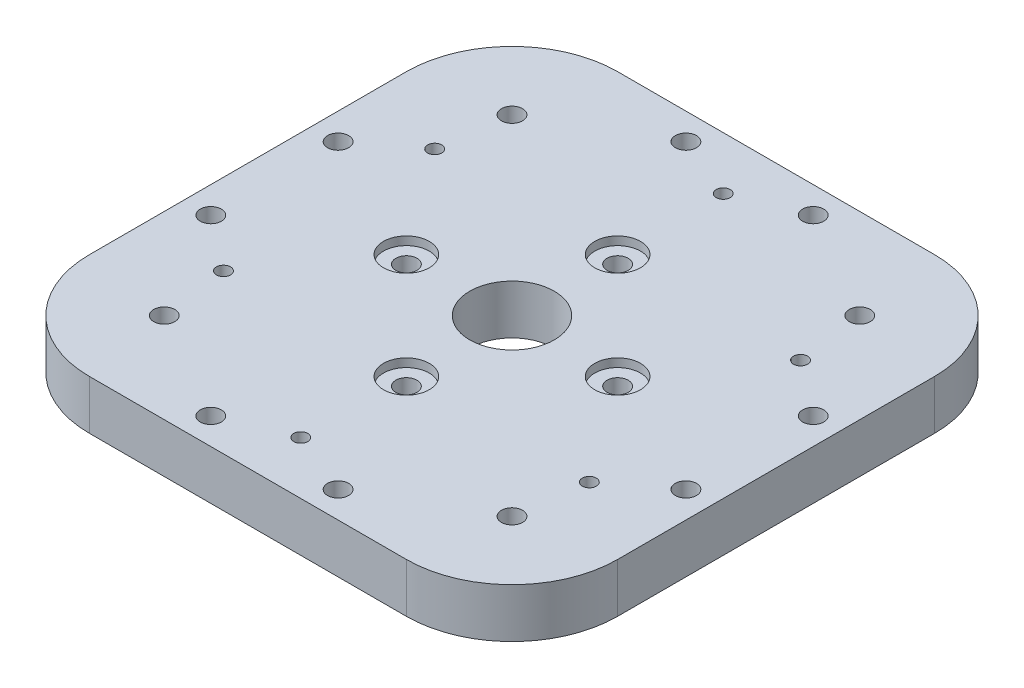
from build123d import *

# Parameters (mm, degrees)
SKETCH1_W           = 75
SKETCH1_H           = 75
SKETCH1_R           = 6
SKETCH1_R_2         = 1.5
SKETCH1_R_3         = 1
BOSS_EXTRUDE1_DEPTH = 7
SKETCH2_R           = 3.25
CUT_EXTRUDE1_DEPTH  = 1.2
FILLET1_R           = 15


with BuildPart() as part:
    # Sketch1 → Boss-Extrude1 (new body)
    with BuildSketch(Plane(origin=(0, 0, 0), x_dir=(1, 0, 0), z_dir=(0, 1, 0))):
        Rectangle(SKETCH1_W, SKETCH1_H)
        Circle(SKETCH1_R, mode=Mode.SUBTRACT)
        with Locations((0, 15)):
            Circle(SKETCH1_R_2, mode=Mode.SUBTRACT)
        with Locations((15, 0)):
            Circle(SKETCH1_R_2, mode=Mode.SUBTRACT)
        with Locations((0, -15)):
            Circle(SKETCH1_R_2, mode=Mode.SUBTRACT)
        with Locations((-15, 0)):
            Circle(SKETCH1_R_2, mode=Mode.SUBTRACT)
        with Locations((-33.737040436, -9.03981274)):
            Circle(SKETCH1_R_2, mode=Mode.SUBTRACT)
        with Locations((-33.737040436, 9.03981274)):
            Circle(SKETCH1_R_2, mode=Mode.SUBTRACT)
        with Locations((-24.697227696, 24.697227696)):
            Circle(SKETCH1_R_2, mode=Mode.SUBTRACT)
        with Locations((-9.03981274, 33.737040436)):
            Circle(SKETCH1_R_2, mode=Mode.SUBTRACT)
        with Locations((9.03981274, 33.737040436)):
            Circle(SKETCH1_R_2, mode=Mode.SUBTRACT)
        with Locations((24.697227696, 24.697227696)):
            Circle(SKETCH1_R_2, mode=Mode.SUBTRACT)
        with Locations((33.737040436, 9.03981274)):
            Circle(SKETCH1_R_2, mode=Mode.SUBTRACT)
        with Locations((33.737040436, -9.03981274)):
            Circle(SKETCH1_R_2, mode=Mode.SUBTRACT)
        with Locations((24.697227696, -24.697227696)):
            Circle(SKETCH1_R_2, mode=Mode.SUBTRACT)
        with Locations((9.03981274, -33.737040436)):
            Circle(SKETCH1_R_2, mode=Mode.SUBTRACT)
        with Locations((-9.03981274, -33.737040436)):
            Circle(SKETCH1_R_2, mode=Mode.SUBTRACT)
        with Locations((-24.697227696, -24.697227696)):
            Circle(SKETCH1_R_2, mode=Mode.SUBTRACT)
        with Locations((0, 30)):
            Circle(SKETCH1_R_3, mode=Mode.SUBTRACT)
        with Locations((25.980762114, 15)):
            Circle(SKETCH1_R_3, mode=Mode.SUBTRACT)
        with Locations((25.980762114, -15)):
            Circle(SKETCH1_R_3, mode=Mode.SUBTRACT)
        with Locations((0, -30)):
            Circle(SKETCH1_R_3, mode=Mode.SUBTRACT)
        with Locations((-25.980762114, -15)):
            Circle(SKETCH1_R_3, mode=Mode.SUBTRACT)
        with Locations((-25.980762114, 15)):
            Circle(SKETCH1_R_3, mode=Mode.SUBTRACT)
    extrude(amount=BOSS_EXTRUDE1_DEPTH)

    # Sketch2 → Cut-Extrude1 (cut)
    with BuildSketch(Plane(origin=(0, 7, 0), x_dir=(1, 0, 0), z_dir=(0, 1, 0))):
        with Locations((0, 15)):
            Circle(SKETCH2_R)
        with Locations((15, 0)):
            Circle(SKETCH2_R)
        with Locations((0, -15)):
            Circle(SKETCH2_R)
        with Locations((-15, 0)):
            Circle(SKETCH2_R)
    extrude(amount=-CUT_EXTRUDE1_DEPTH, mode=Mode.SUBTRACT)

    # Fillet1
    fillet1_edges = [part.edges().sort_by_distance(p)[0] for p in [
        (-37.5, 3.5, -37.5),
        (-37.5, 3.5, 37.5),
        (37.5, 3.5, 37.5),
        (37.5, 3.5, -37.5),
    ]]
    fillet(fillet1_edges, radius=FILLET1_R)


solid = part.part
